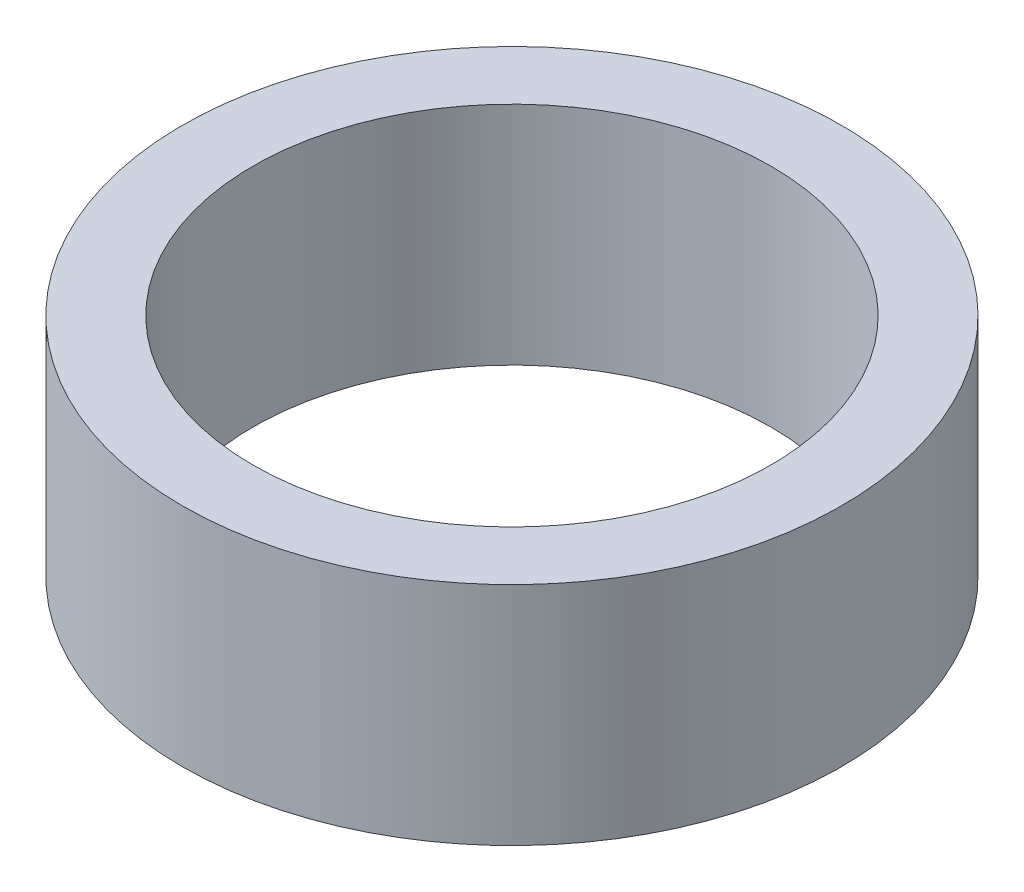
from build123d import *

# Parameters (mm, degrees)
SKETCH1_R           = 35
BOSS_EXTRUDE1_DEPTH = 24
SKETCH2_R           = 27.5
CUT_EXTRUDE1_DEPTH  = 56.009090158


with BuildPart() as part:
    # Sketch1 → Boss-Extrude1 (new body)
    with BuildSketch(Plane(origin=(0, 0, 0), x_dir=(1, 0, 0), z_dir=(0, 1, 0))):
        Circle(SKETCH1_R)
    extrude(amount=BOSS_EXTRUDE1_DEPTH)

    # Sketch2 → Cut-Extrude1 (cut, through all)
    with BuildSketch(Plane(origin=(0, 0, 0), x_dir=(1, 0, 0), z_dir=(0, 1, 0))):
        Circle(SKETCH2_R)
    extrude(amount=CUT_EXTRUDE1_DEPTH, mode=Mode.SUBTRACT)


solid = part.part
